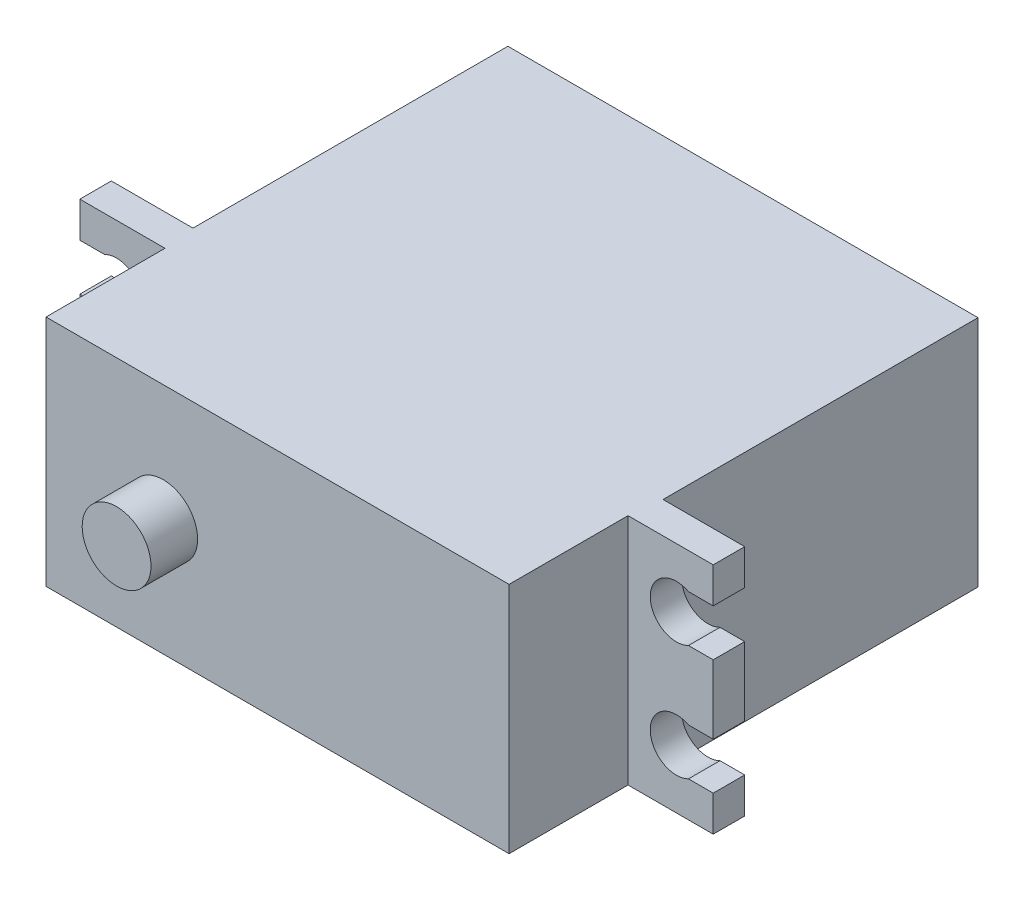
from build123d import *

# Parameters (mm, degrees)
SKETCH1_W           = 40.3
SKETCH1_H           = 27
BOSS_EXTRUDE1_DEPTH = 20
BOSS_EXTRUDE2_DEPTH = 2.7
SKETCH3_W           = 39.7
SKETCH3_H           = 20
BOSS_EXTRUDE3_DEPTH = 10.2
SKETCH4_R           = 2.95
BOSS_EXTRUDE4_DEPTH = 4
SKETCH5_W           = 3.501362038
SKETCH5_H           = 11.379426624
BOSS_EXTRUDE5_DEPTH = 4


with BuildPart() as part:
    # Sketch1 → Boss-Extrude1 (new body)
    with BuildSketch(Plane(origin=(0, 0, 0), x_dir=(1, 0, 0), z_dir=(0, 1, 0))):
        Rectangle(SKETCH1_W, SKETCH1_H)
    extrude(amount=BOSS_EXTRUDE1_DEPTH)

    # Sketch2 → Boss-Extrude2 (add)
    with BuildSketch(Plane.XY.offset(13.5)):
        with BuildLine():
            ThreePointArc((-25.030776406, 16.95), (-21.75, 14.95), (-25.030776406, 12.95))
            Line((-25.030776406, 12.95), (-27.15, 12.95))
            Line((-27.15, 12.95), (-27.15, 7.05))
            Line((-27.15, 7.05), (-25.030776406, 7.05))
            ThreePointArc((-25.030776406, 7.05), (-21.75, 5.05), (-25.030776406, 3.05))
            Line((-25.030776406, 3.05), (-27.15, 3.05))
            Line((-27.15, 3.05), (-27.15, 0))
            Line((-27.15, 0), (27.15, 0))
            Line((27.15, 0), (27.15, 3.05))
            Line((27.15, 3.05), (25.030776406, 3.05))
            ThreePointArc((25.030776406, 3.05), (21.75, 5.05), (25.030776406, 7.05))
            Line((25.030776406, 7.05), (27.15, 7.05))
            Line((27.15, 7.05), (27.15, 12.95))
            Line((27.15, 12.95), (25.030776406, 12.95))
            ThreePointArc((25.030776406, 12.95), (21.75, 14.95), (25.030776406, 16.95))
            Line((25.030776406, 16.95), (27.15, 16.95))
            Line((27.15, 16.95), (27.15, 20))
            Line((27.15, 20), (-27.15, 20))
            Line((-27.15, 20), (-27.15, 16.95))
            Line((-27.15, 16.95), (-25.030776406, 16.95))
        make_face()
    extrude(amount=BOSS_EXTRUDE2_DEPTH)

    # Sketch3 → Boss-Extrude3 (add)
    with BuildSketch(Plane.XY.offset(16.2)):
        with Locations((0, 10)):
            Rectangle(SKETCH3_W, SKETCH3_H)
    extrude(amount=BOSS_EXTRUDE3_DEPTH)

    # Sketch4 → Boss-Extrude4 (add)
    with BuildSketch(Plane.XY.offset(26.4)):
        with Locations((-9.8, 10)):
            Circle(SKETCH4_R)
    extrude(amount=BOSS_EXTRUDE4_DEPTH)

    # Sketch5 → Boss-Extrude5 (add)
    with BuildSketch(Plane.ZY.offset(20.15)):
        with Locations((-8.667769888, 10)):
            Rectangle(SKETCH5_W, SKETCH5_H)
    extrude(amount=BOSS_EXTRUDE5_DEPTH)


solid = part.part
